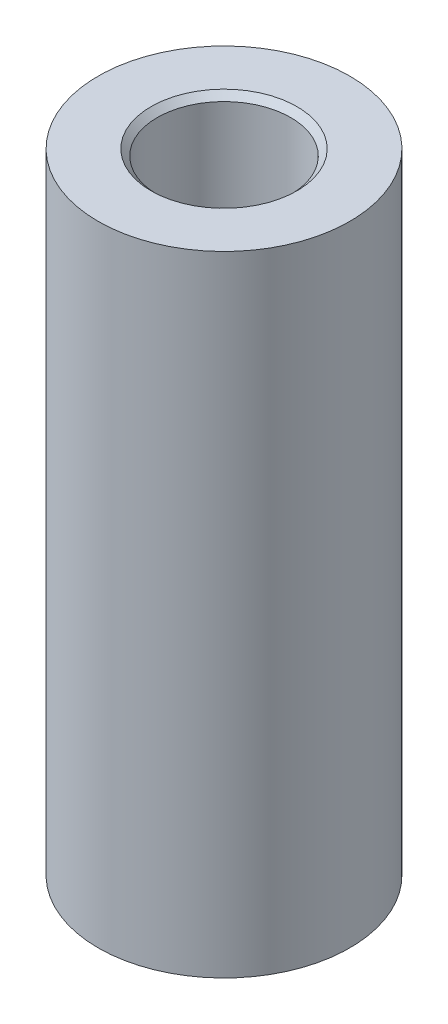
from build123d import *

# Parameters (mm, degrees)
SKETCH1_R            = 5
BOSS_EXTRUDE1_DEPTH  = 12.5
M5_CLEARANCE_HOLE1_D = 5.3
CHAMFER1_SIZE        = 0.25


with BuildPart() as part:
    # Sketch1 → Boss-Extrude1 (new, symmetric)
    with BuildSketch(Plane(origin=(0, 0, 0), x_dir=(1, 0, 0), z_dir=(0, 1, 0))):
        Circle(SKETCH1_R)
    extrude(amount=BOSS_EXTRUDE1_DEPTH, both=True)

    # M5 Clearance Hole1 (through all)
    with Locations(Plane(origin=(0, 12.5, 0), x_dir=(1, 0, 0), z_dir=(0, 1, 0))):
        with Locations((0, 0)):
            Hole(M5_CLEARANCE_HOLE1_D / 2)

    # Chamfer1
    chamfer1_edges = [part.edges().sort_by_distance(p)[0] for p in [
        (2.65, 12.5, 0),
        (2.65, -12.5, 0),
    ]]
    chamfer(chamfer1_edges, length=CHAMFER1_SIZE)


solid = part.part
